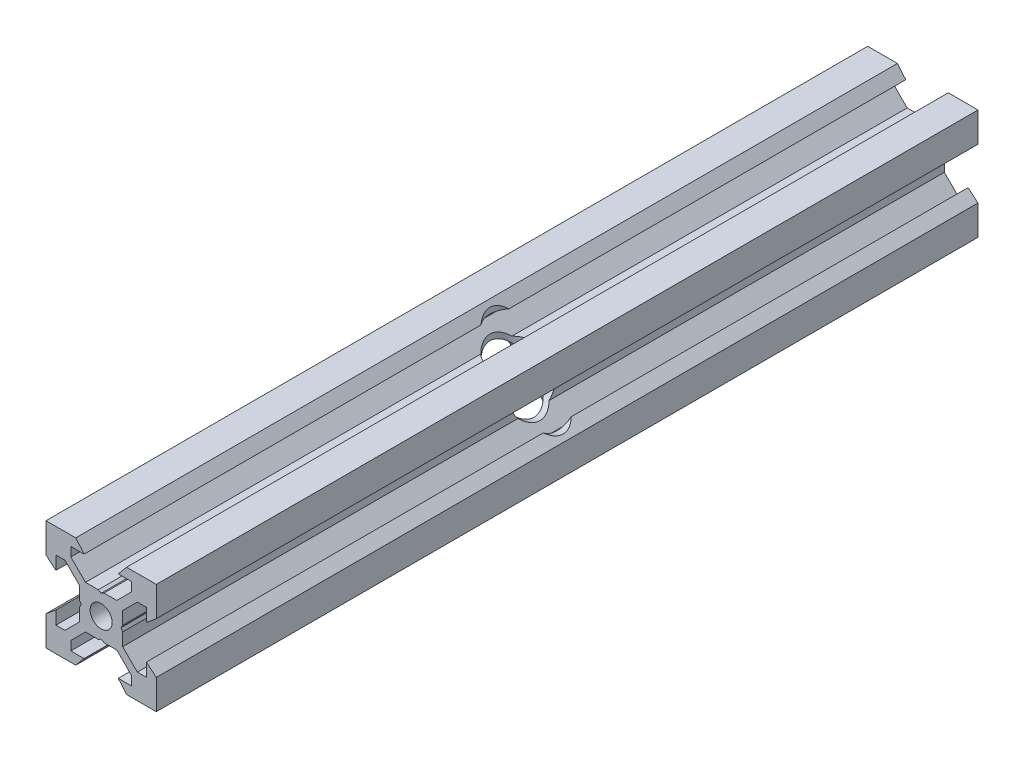
from build123d import *

# Parameters (mm, degrees)
SKETCH1_R               = 2
BOSS_EXTRUDE1_DEPTH     = 149
CUT_EXTRUDE1_DEPTH      = 150.669636199
CUT_EXTRUDE1_DEPTH_BACK = 150.669636199
SKETCH4_R               = 4
CUT_EXTRUDE2_DEPTH      = 150.669636299
CUT_EXTRUDE2_DEPTH_BACK = 150.669636299
SKETCH5_R               = 4


with BuildPart() as part:
    # Sketch1 → Boss-Extrude1 (new body)
    with BuildSketch(Plane.XY):
        Polygon((10, 4.610379336), (10, 10), (4.610379336, 10), (3.1, 8.2), (5.5, 8.2), (5.5, 6.560660172), (2.839339828, 3.9), (0.519615242, 3.9), (0, 3.6), (-0.519615242, 3.9), (-2.839339828, 3.9), (-5.5, 6.560660172), (-5.5, 8.2), (-3.1, 8.2), (-4.610379336, 10), (-10, 10), (-10, 4.610379336), (-8.2, 3.1), (-8.2, 5.5), (-6.560660172, 5.5), (-3.9, 2.839339828), (-3.9, 0.519615242), (-3.6, 0), (-3.9, -0.519615242), (-3.9, -2.839339828), (-6.560660172, -5.5), (-8.2, -5.5), (-8.2, -3.1), (-10, -4.610379336), (-10, -10), (-4.610379336, -10), (-3.1, -8.2), (-5.5, -8.2), (-5.5, -6.560660172), (-2.839339828, -3.9), (-0.519615242, -3.9), (0, -3.6), (0.519615242, -3.9), (2.839339828, -3.9), (5.5, -6.560660172), (5.5, -8.2), (3.1, -8.2), (4.610379336, -10), (10, -10), (10, -4.610379336), (8.2, -3.1), (8.2, -5.5), (6.560660172, -5.5), (3.9, -2.839339828), (3.9, -0.519615242), (3.6, 0), (3.9, 0.519615242), (3.9, 2.839339828), (6.560660172, 5.5), (8.2, 5.5), (8.2, 3.1), align=None)
        Circle(SKETCH1_R, mode=Mode.SUBTRACT)
    extrude(amount=BOSS_EXTRUDE1_DEPTH)

    # Sketch4 → Cut-Extrude1 (cut, two sides: drawn at the far end of the back side and taken through both)
    with BuildSketch(Plane(origin=(0, 0, 0), x_dir=(0, 0, -1), z_dir=(1, 0, 0)).offset(-CUT_EXTRUDE1_DEPTH_BACK)):
        with Locations((-74.5, 0)):
            Circle(SKETCH4_R)
    extrude(amount=CUT_EXTRUDE1_DEPTH + CUT_EXTRUDE1_DEPTH_BACK, mode=Mode.SUBTRACT)

    # Sketch5 → Cut-Extrude2 (cut, two sides: drawn at the far end of the back side and taken through both)
    with BuildSketch(Plane(origin=(0, 0, 0), x_dir=(1, 0, 0), z_dir=(0, 1, 0)).offset(-CUT_EXTRUDE2_DEPTH_BACK)):
        with Locations((0, -74.5)):
            Circle(SKETCH5_R)
    extrude(amount=CUT_EXTRUDE2_DEPTH + CUT_EXTRUDE2_DEPTH_BACK, mode=Mode.SUBTRACT)


solid = part.part
